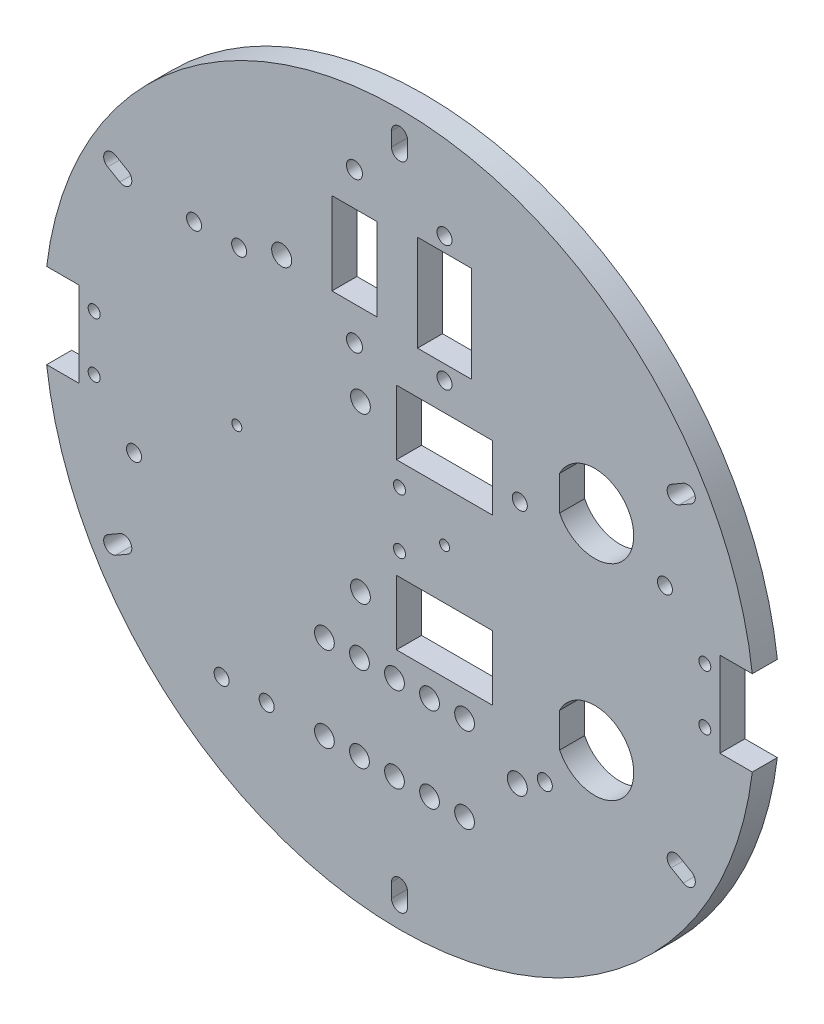
from build123d import *

# Parameters (mm, degrees)
ESQUISSE1_R                     = 71
BOSS_EXTRU_1_DEPTH              = 5
ESQUISSE2_W                     = 33.992340046
ESQUISSE2_H                     = 17
ESQUISSE2_W_2                   = 21.861356716
ENL_V_MAT_EXTRU_1_DEPTH         = 101.533576481
D_GAGEMENT_M21_D                = 2.4
R_P_TITION_LIN_AIRE1_COUNT      = 3
R_P_TITION_LIN_AIRE1_PITCH      = 61
R_P_TITION_LIN_AIRE1_COUNT_DIR2 = 2
R_P_TITION_LIN_AIRE1_PITCH_DIR2 = 11
ESQUISSE7_R                     = 1
ENL_V_MAT_EXTRU_2_DEPTH         = 10
ENL_V_MAT_EXTRU_3_DEPTH         = 101.173599316
D_GAGEMENT_M25_DEPTH            = 5
R_P_TITION_CIRCULAIRE1_COUNT    = 6
ESQUISSE11_R                    = 1.6
ESQUISSE11_R_2                  = 1.5
ESQUISSE11_R_3                  = 1.975
ESQUISSE11_R_4                  = 1
ESQUISSE11_W                    = 19.2
ESQUISSE11_H                    = 12.9
ESQUISSE11_W_2                  = 9
ESQUISSE11_H_2                  = 16.5
ESQUISSE11_W_3                  = 10.8
ESQUISSE11_H_3                  = 19.2
ENL_V_MAT_EXTRU_4_DEPTH         = 101.173599316
ESQUISSE12_R                    = 1.975
ENL_V_MAT_EXTRU_5_DEPTH         = 101.173599316
R_P_TITION_LIN_AIRE3_COUNT      = 5
R_P_TITION_LIN_AIRE3_PITCH      = 7
R_P_TITION_LIN_AIRE3_COUNT_DIR2 = 2
R_P_TITION_LIN_AIRE3_PITCH_DIR2 = 17
ESQUISSE13_R                    = 2
ENL_V_MAT_EXTRU_6_DEPTH         = 101.173599316
R_P_TITION_CIRCULAIRE2_COUNT    = 2
ESQUISSE15_R                    = 1.5
ENL_V_MAT_EXTRU_8_DEPTH         = 10


# Read off the part's stored shape, not the designer's step: Dégagement M25
with BuildPart() as part:
    # Esquisse1 → Boss.-Extru.1 (new body)
    with BuildSketch(Plane.XY):
        Circle(ESQUISSE1_R)
    extrude(amount=BOSS_EXTRU_1_DEPTH)

    # Esquisse2 → Enlèv. mat.-Extru.1 (cut, through all)
    with BuildSketch(Plane.XY.offset(5)):
        with Locations((80.996170023, 0)):
            Rectangle(ESQUISSE2_W, ESQUISSE2_H)
        with Locations((-74.930678358, 0)):
            Rectangle(ESQUISSE2_W_2, ESQUISSE2_H)
    extrude(amount=-ENL_V_MAT_EXTRU_1_DEPTH, mode=Mode.SUBTRACT)

    # Dégagement M21 (through all)
    with Locations(Plane(origin=(0, 0, 0), x_dir=(-1, 0, 0), z_dir=(0, 0, -1))):
        with Locations((-61, -5.5)):
            d_gagement_m21 = Hole(D_GAGEMENT_M21_D / 2)

    # Répétition linéaire1: D_gagement M21 3 × 2
    with Locations(*[(-i * R_P_TITION_LIN_AIRE1_PITCH, j * R_P_TITION_LIN_AIRE1_PITCH_DIR2, 0) for i in range(R_P_TITION_LIN_AIRE1_COUNT) for j in range(R_P_TITION_LIN_AIRE1_COUNT_DIR2) if (i, j) != (0, 0)]):
        add(d_gagement_m21, mode=Mode.SUBTRACT)

    # Esquisse7 → Enlèv. mat.-Extru.2 (cut)
    with BuildSketch(Plane(origin=(0, 0, 0), x_dir=(-1, 0, 0), z_dir=(0, 0, -1))):
        with Locations((32.5, 0)):
            Circle(ESQUISSE7_R)
    extrude(amount=-ENL_V_MAT_EXTRU_2_DEPTH, mode=Mode.SUBTRACT)

    # Esquisse8 → Enlèv. mat.-Extru.3 (cut, through all)
    with BuildSketch(Plane.XY.offset(5)):
        with BuildLine():
            Line((32, 23.940930107), (32, 17.059069893))
            ThreePointArc((32, 17.059069893), (46.8, 20.5), (32, 23.940930107))
        make_face()
        with BuildLine():
            Line((32, -23.940930107), (32, -17.059069893))
            ThreePointArc((32, -17.059069893), (46.8, -20.5), (32, -23.940930107))
        make_face()
    extrude(amount=-ENL_V_MAT_EXTRU_3_DEPTH, mode=Mode.SUBTRACT)

    # Dégagement M25 outline → Dégagement M25 (cut)
    with BuildSketch(Plane.XY):
        with BuildLine():
            Line((54.279215681, -33.185640646), (56.704086811, -34.585640646))
            ThreePointArc((56.704086811, -34.585640646), (58.889727457, -34), (58.304086811, -31.814359354))
            Line((58.304086811, -31.814359354), (55.879215681, -30.414359354))
            ThreePointArc((55.879215681, -30.414359354), (53.693575035, -31), (54.279215681, -33.185640646))
        make_face()
    d_gagement_m25 = extrude(amount=D_GAGEMENT_M25_DEPTH, mode=Mode.SUBTRACT)

    # Répétition circulaire1: Dégagement M25 ×6 about axis
    r_p_tition_circulaire1_axis = Axis((0, 0, 0), (0, 0, 1))
    for i in range(1, R_P_TITION_CIRCULAIRE1_COUNT):
        add(d_gagement_m25.rotate(r_p_tition_circulaire1_axis, i * 360 / R_P_TITION_CIRCULAIRE1_COUNT), mode=Mode.SUBTRACT)

    # Esquisse11 → Enlèv. mat.-Extru.4 (cut, through all)
    with BuildSketch(Plane(origin=(0, 0, 0), x_dir=(-1, 0, 0), z_dir=(0, 0, -1))):
        with Locations((9, 26)):
            Circle(ESQUISSE11_R)
        with Locations((9, 56)):
            Circle(ESQUISSE11_R)
        with Locations((-9, 28.5)):
            Circle(ESQUISSE11_R_2)
        with Locations((-9, 53.5)):
            Circle(ESQUISSE11_R_2)
        with Locations((7.8, 16.45)):
            Circle(ESQUISSE11_R_3)
        with Locations(Location((7.8, -16.45, 0), (0, 0, 180))):
            Circle(ESQUISSE11_R_3)
        with Locations((-9, 0)):
            Circle(ESQUISSE11_R_4)
        with Locations((-9, -16.45)):
            Rectangle(ESQUISSE11_W, ESQUISSE11_H)
        with Locations((-9, 16.45)):
            Rectangle(ESQUISSE11_W, ESQUISSE11_H)
        with Locations((9, 41)):
            Rectangle(ESQUISSE11_W_2, ESQUISSE11_H_2)
        with Locations((-9, 41)):
            Rectangle(ESQUISSE11_W_3, ESQUISSE11_H_3)
    extrude(amount=-ENL_V_MAT_EXTRU_4_DEPTH, mode=Mode.SUBTRACT)

    # Esquisse12 → Enlèv. mat.-Extru.5 (cut, through all)
    with BuildSketch(Plane.XY.offset(5)):
        with Locations((-15, -45)):
            Circle(ESQUISSE12_R)
    enl_v_mat_extru_5 = extrude(amount=-ENL_V_MAT_EXTRU_5_DEPTH, mode=Mode.SUBTRACT)

    # Répétition linéaire3: Enl_v. mat.-Extru.5 5 × 2
    with Locations(*[(i * R_P_TITION_LIN_AIRE3_PITCH, j * R_P_TITION_LIN_AIRE3_PITCH_DIR2, 0) for i in range(R_P_TITION_LIN_AIRE3_COUNT) for j in range(R_P_TITION_LIN_AIRE3_COUNT_DIR2) if (i, j) != (0, 0)]):
        add(enl_v_mat_extru_5, mode=Mode.SUBTRACT)

    # Esquisse13 → Enlèv. mat.-Extru.6 (cut, through all)
    with BuildSketch(Plane(origin=(0, 0, 0), x_dir=(-1, 0, 0), z_dir=(0, 0, -1))):
        with Locations((23.5374475, 33.959943273)):
            Circle(ESQUISSE13_R)
    enl_v_mat_extru_6 = extrude(amount=-ENL_V_MAT_EXTRU_6_DEPTH, mode=Mode.SUBTRACT)

    # Répétition circulaire2: Enlèv. mat.-Extru.6 ×2 about axis
    r_p_tition_circulaire2_axis = Axis((0, 0, 0), (0, 0, 1))
    for i in range(1, R_P_TITION_CIRCULAIRE2_COUNT):
        add(enl_v_mat_extru_6.rotate(r_p_tition_circulaire2_axis, i * 360 / R_P_TITION_CIRCULAIRE2_COUNT), mode=Mode.SUBTRACT)

    # Esquisse15 → Enlèv. mat.-Extru.8 (cut)
    with BuildSketch(Plane.XY.offset(5)):
        with Locations((53.035, 15.040056727)):
            Circle(ESQUISSE15_R)
        with Locations((24.035, 15.040056727)):
            Circle(ESQUISSE15_R)
        with Locations((29.035, -30.959943273)):
            Circle(ESQUISSE15_R)
        with Locations((-35.5374475, -45.040056727)):
            Circle(ESQUISSE15_R)
        with Locations((-26.5374475, -45.040056727)):
            Circle(ESQUISSE15_R)
        with Locations((-41.0374475, 30.959943273)):
            Circle(ESQUISSE15_R)
        with Locations((-32.0374475, 30.959943273)):
            Circle(ESQUISSE15_R)
        with Locations((-53.0374475, -15.040056727)):
            Circle(ESQUISSE15_R)
    extrude(amount=-ENL_V_MAT_EXTRU_8_DEPTH, mode=Mode.SUBTRACT)


solid = part.part
